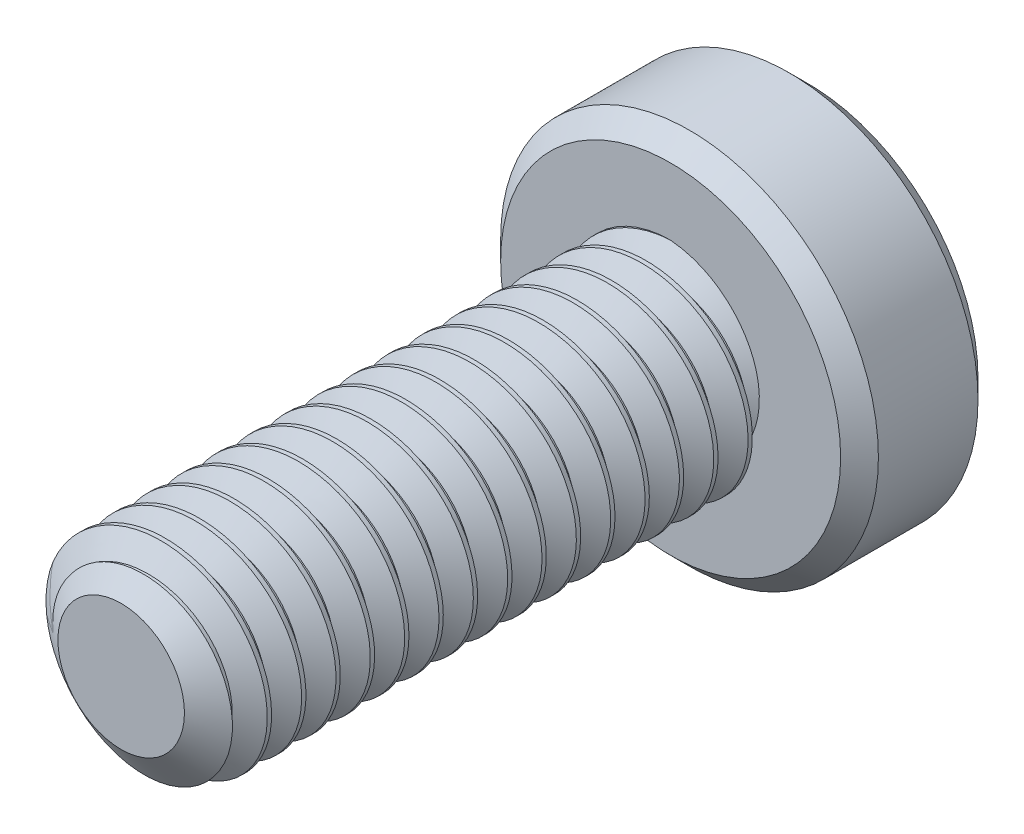
from build123d import *

# Parameters (mm, degrees)
SKETCH1_R          = 1.5
EXTRUDE1_DEPTH     = 8
CUT_SWEEP1_PITCH   = 0.5
SKETCH6_R          = 2.75
EXTRUDE2_DEPTH     = 2
CUT_EXTRUDE1_DEPTH = 1.5
CHAMFER1_SIZE      = 0.275


with BuildPart() as part:
    # Sketch1 → Extrude1 (new body)
    with BuildSketch(Plane.XY):
        Circle(SKETCH1_R)
    extrude(amount=-EXTRUDE1_DEPTH)

    # Cut-Sweep1: arcs per turn and ends read off the stored shape
    # Cut-Sweep1: the profile of Sketch3 profile screwed along a right-hand helix through 19 turns, 6 arcs to a turn; built about Z, then put on its axis
    cut_sweep1_z = Axis((0, 0, 0), (0, 0, 1))
    cut_sweep1_corners = [(1.5003, 0, -0.937673205), (1.175240474, 0, -0.75), (1.175240474, 0, -0.6875), (1.5003, 0, -0.499826795)]
    with BuildLine(mode=Mode.PRIVATE) as cut_sweep1_profile:
        Line(cut_sweep1_corners[0], cut_sweep1_corners[1])
        Line(cut_sweep1_corners[1], cut_sweep1_corners[2])
        Line(cut_sweep1_corners[2], cut_sweep1_corners[3])
        Line(cut_sweep1_corners[3], cut_sweep1_corners[0])
    cut_sweep1_cap = Face(cut_sweep1_profile.wire())
    cut_sweep1_turn_angles = [0, 30, 60, 90, 120, 150, 180, 210, 240, 270, 300, 330, 360]
    cut_sweep1_turn_weights = [1, 0.8660254037844387, 1, 0.8660254037844387, 1, 0.8660254037844387, 1, 0.8660254037844387, 1, 0.8660254037844387, 1, 0.8660254037844387, 1]
    cut_sweep1_turn_rails = [Edge.make_bspline([Vector(p[0], p[1], 0).rotate(cut_sweep1_z, cut_sweep1_turn_angles[k]) / cut_sweep1_turn_weights[k] + Vector(0, 0, p[2] + CUT_SWEEP1_PITCH * cut_sweep1_turn_angles[k] / 360) for k in range(13)], [0, 0, 0, 1, 1, 2, 2, 3, 3, 4, 4, 5, 5, 6, 6, 6], 2, cut_sweep1_turn_weights) for p in cut_sweep1_corners]
    cut_sweep1_turn_sides = [Face.make_surface_from_curves(cut_sweep1_turn_rails[p[0]], cut_sweep1_turn_rails[p[1]]) for p in [(0, 1), (1, 2), (2, 3), (3, 0)]]
    cut_sweep1 = Plane(origin=(0, 0, 0), x_dir=(0, 1, 0), z_dir=(0, 0, -1)) * Solid(Shell([*[p.moved(Location((0, 0, CUT_SWEEP1_PITCH * i))) for i in range(19) for p in cut_sweep1_turn_sides], cut_sweep1_cap, cut_sweep1_cap.rotate(cut_sweep1_z, 6840).moved(Location((0, 0, CUT_SWEEP1_PITCH * 6840 / 360)))]))
    add(cut_sweep1, mode=Mode.SUBTRACT)

    # Sketch4 → Cut-Revolve1 (revolve, cut)
    with BuildSketch(Plane(origin=(0, 0, 0), x_dir=(0, 0, -1), z_dir=(1, 0, 0)), mode=Mode.PRIVATE) as cut_revolve1_sk:
        Polygon((0.405251783, 1.5), (0, 0.921240474), (0, 1.5), align=None)
    revolve(cut_revolve1_sk.sketch.rotate(Axis((0, 0, 0), (0, 0, -1)), 263.352109169), axis=Axis((0, 0, 0), (0, 0, -1)), mode=Mode.SUBTRACT)

    # Sketch6 → Extrude2 (add)
    with BuildSketch(Plane(origin=(0, 0, -8), x_dir=(-1, 0, 0), z_dir=(0, 0, -1))):
        with Locations(Location((0, 0, 0), (0, 0, 180))):
            Circle(SKETCH6_R)
    extrude(amount=EXTRUDE2_DEPTH)

    # Sketch7 → Cut-Extrude1 (cut)
    with BuildSketch(Plane(origin=(0, 0, -10), x_dir=(-1, 0, 0), z_dir=(0, 0, -1))):
        Polygon((0, 1.154700538), (-1, 0.577350269), (-1, -0.577350269), (0, -1.154700538), (1, -0.577350269), (1, 0.577350269), align=None)
    extrude(amount=-CUT_EXTRUDE1_DEPTH, mode=Mode.SUBTRACT)

    # Cut-Extrude2 cone 1 section (through the dimple's axis) → Cut-Extrude2 (revolve, cut)
    with BuildSketch(Plane(origin=(0, 0, -10), x_dir=(0, 1, 0), z_dir=(1, 0, 0))):
        Polygon((0, 0), (1.154700538, 0), (0, 1.154700538), align=None)
    revolve(axis=Axis((0, 0, -10), (0, 0, 1)), mode=Mode.SUBTRACT)

    # Chamfer1
    chamfer1_edges = [part.edges().sort_by_distance(p)[0] for p in [
        (-2.75, 0, -8),
        (-2.75, 0, -10),
    ]]
    chamfer(chamfer1_edges, length=CHAMFER1_SIZE)


solid = part.part
